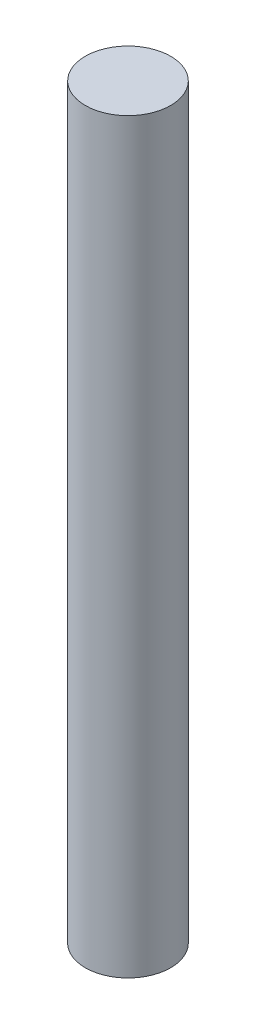
from build123d import *

# Parameters (mm, degrees)
SKETCH1_R           = 1
BOSS_EXTRUDE1_DEPTH = 17.5
SCALE1_SCALE        = 6


with BuildPart() as part:
    # Sketch1 → Boss-Extrude1 (new body)
    with BuildSketch(Plane(origin=(0, 0, 0), x_dir=(1, 0, 0), z_dir=(0, 1, 0))):
        Circle(SKETCH1_R)
    extrude(amount=BOSS_EXTRUDE1_DEPTH)


with BuildPart() as part_1:
    # Scale1: scaled about (0, 8.75, 0)
    add(part.part.scale(SCALE1_SCALE).moved(Location((0, -43.75, 0))))


solid = part_1.part
